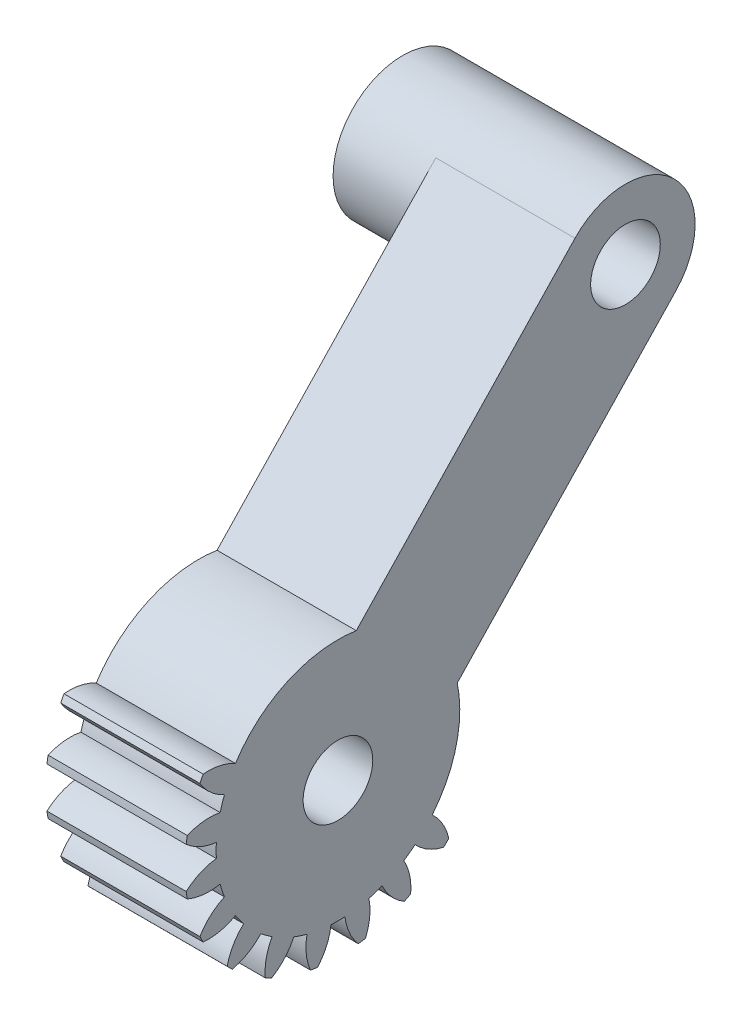
from build123d import *
from build123d.topology import SkipClean

# Parameters (mm, degrees)
SKETCH1_R           = 2.5
BOSS_EXTRUDE1_DEPTH = 10
SKETCH2_R           = 2.5
BOSS_EXTRUDE2_DEPTH = 10
SKETCH3_R           = 5
SKETCH3_R_2         = 2.5
BOSS_EXTRUDE3_DEPTH = 6
SKETCH4_R           = 2.5
CUT_EXTRUDE1_DEPTH  = 41.209967862
CUT_EXTRUDE2_DEPTH  = 41.209967862


with BuildPart() as part:
    # Sketch1 → Boss-Extrude1 (new body)
    with BuildSketch(Plane(origin=(4.043870029, 0, 0), x_dir=(0, 0, -1), z_dir=(1, 0, 0))):
        with BuildLine():
            ThreePointArc((-10.029541992, 0.342879069), (-9.019080639, -0.304016541), (-7.862233613, -0.622153359))
            ThreePointArc((-7.862233613, -0.622153359), (-7.876528296, -1.122077366), (-7.862233613, -1.622001374))
            ThreePointArc((-7.862233613, -1.622001374), (-9.019080639, -1.940138191), (-10.029541992, -2.587033801))
            ThreePointArc((-10.029541992, -2.587033801), (-9.992100042, -2.842856482), (-9.948655897, -3.097728508))
            ThreePointArc((-9.948655897, -3.097728508), (-8.787748306, -3.400713063), (-7.58921172, -3.345793765))
            ThreePointArc((-7.58921172, -3.345793765), (-7.448321757, -3.82566705), (-7.280241692, -4.296705735))
            ThreePointArc((-7.280241692, -4.296705735), (-8.282158911, -4.956757219), (-9.043263028, -5.884241235))
            ThreePointArc((-9.043263028, -5.884241235), (-8.928600062, -6.115972863), (-8.808522437, -6.344945585))
            ThreePointArc((-8.808522437, -6.344945585), (-7.610806331, -6.274360846), (-6.487901298, -5.851761317))
            ThreePointArc((-6.487901298, -5.851761317), (-6.20561798, -6.264610538), (-5.90020538, -6.660655353))
            ThreePointArc((-5.90020538, -6.660655353), (-6.649118154, -7.598011066), (-7.086362862, -8.715294889))
            ThreePointArc((-7.086362862, -8.715294889), (-6.905702889, -8.900251959), (-6.720745819, -9.080911932))
            ThreePointArc((-6.720745819, -9.080911932), (-5.603461996, -8.643667224), (-4.666106283, -7.89475445))
            ThreePointArc((-4.666106283, -7.89475445), (-4.270061468, -8.20016705), (-3.857212247, -8.482450368))
            ThreePointArc((-3.857212247, -8.482450368), (-4.279811776, -9.605355401), (-4.350396515, -10.803071507))
            ThreePointArc((-4.350396515, -10.803071507), (-4.121423793, -10.923149132), (-3.889692165, -11.037812099))
            ThreePointArc((-3.889692165, -11.037812099), (-2.962208149, -10.276707981), (-2.302156665, -9.274790762))
            ThreePointArc((-2.302156665, -9.274790762), (-1.83111798, -9.442870827), (-1.351244695, -9.583760791))
            ThreePointArc((-1.351244695, -9.583760791), (-1.406163992, -10.782297376), (-1.103179437, -11.943204968))
            ThreePointArc((-1.103179437, -11.943204968), (-0.848307411, -11.986649113), (-0.592484731, -12.024091063))
            ThreePointArc((-0.592484731, -12.024091063), (0.054410879, -11.01362971), (0.372547697, -9.856782684))
            ThreePointArc((0.372547697, -9.856782684), (0.872471704, -9.871077366), (1.372395712, -9.856782684))
            ThreePointArc((1.372395712, -9.856782684), (1.690532529, -11.01362971), (2.337428139, -12.024091063))
            ThreePointArc((2.337428139, -12.024091063), (2.59325082, -11.986649113), (2.848122846, -11.943204968))
            ThreePointArc((2.848122846, -11.943204968), (3.151107401, -10.782297376), (3.096188103, -9.583760791))
            ThreePointArc((3.096188103, -9.583760791), (3.576061388, -9.442870827), (4.047100073, -9.274790762))
            ThreePointArc((4.047100073, -9.274790762), (4.707151558, -10.276707981), (5.634635573, -11.037812099))
            ThreePointArc((5.634635573, -11.037812099), (5.866367201, -10.923149132), (6.095339923, -10.803071507))
            ThreePointArc((6.095339923, -10.803071507), (6.024755184, -9.605355401), (5.602155655, -8.482450368))
            ThreePointArc((5.602155655, -8.482450368), (6.015004877, -8.20016705), (6.411049691, -7.89475445))
            ThreePointArc((6.411049691, -7.89475445), (7.348405404, -8.643667224), (8.465689227, -9.080911932))
            ThreePointArc((8.465689227, -9.080911932), (8.650646297, -8.900251959), (8.83130627, -8.715294889))
            ThreePointArc((8.83130627, -8.715294889), (8.394061563, -7.598011066), (7.645148788, -6.660655353))
            ThreePointArc((7.645148788, -6.660655353), (7.950561388, -6.264610538), (8.232844706, -5.851761317))
            ThreePointArc((8.232844706, -5.851761317), (9.355749739, -6.274360846), (10.553465846, -6.344945585))
            ThreePointArc((10.553465846, -6.344945585), (10.67354347, -6.115972863), (10.788206437, -5.884241235))
            ThreePointArc((10.788206437, -5.884241235), (10.02710232, -4.956757219), (9.0251851, -4.296705735))
            ThreePointArc((9.0251851, -4.296705735), (9.193265165, -3.82566705), (9.334155129, -3.345793765))
            ThreePointArc((9.334155129, -3.345793765), (10.532691714, -3.400713063), (11.693599306, -3.097728508))
            ThreePointArc((11.693599306, -3.097728508), (11.737043451, -2.842856482), (11.774485401, -2.587033801))
            ThreePointArc((11.774485401, -2.587033801), (10.764024048, -1.940138191), (9.607177022, -1.622001374))
            ThreePointArc((9.607177022, -1.622001374), (9.621471704, -1.122077366), (9.607177022, -0.622153359))
            ThreePointArc((9.607177022, -0.622153359), (10.764024048, -0.304016541), (11.774485401, 0.342879069))
            ThreePointArc((11.774485401, 0.342879069), (11.737043451, 0.598701749), (11.693599306, 0.853573775))
            ThreePointArc((11.693599306, 0.853573775), (10.532691714, 1.156558331), (9.334155129, 1.101639033))
            ThreePointArc((9.334155129, 1.101639033), (9.193265165, 1.581512318), (9.0251851, 2.052551003))
            ThreePointArc((9.0251851, 2.052551003), (10.02710232, 2.712602487), (10.788206437, 3.640086503))
            ThreePointArc((10.788206437, 3.640086503), (10.67354347, 3.871818131), (10.553465846, 4.100790853))
            ThreePointArc((10.553465846, 4.100790853), (9.355749739, 4.030206114), (8.232844706, 3.607606585))
            ThreePointArc((8.232844706, 3.607606585), (7.950561388, 4.020455806), (7.645148788, 4.416500621))
            ThreePointArc((7.645148788, 4.416500621), (8.394061563, 5.353856334), (8.83130627, 6.471140157))
            ThreePointArc((8.83130627, 6.471140157), (8.650646297, 6.656097227), (8.465689227, 6.8367572))
            ThreePointArc((8.465689227, 6.8367572), (7.348405404, 6.399512492), (6.411049691, 5.650599718))
            ThreePointArc((6.411049691, 5.650599718), (6.015004877, 5.956012318), (5.602155655, 6.238295636))
            ThreePointArc((5.602155655, 6.238295636), (6.024755184, 7.361200669), (6.095339923, 8.558916775))
            ThreePointArc((6.095339923, 8.558916775), (5.866367201, 8.6789944), (5.634635573, 8.793657366))
            ThreePointArc((5.634635573, 8.793657366), (4.707151558, 8.032553249), (4.047100073, 7.03063603))
            ThreePointArc((4.047100073, 7.03063603), (3.576061388, 7.198716095), (3.096188103, 7.339606058))
            ThreePointArc((3.096188103, 7.339606058), (3.151107401, 8.538142644), (2.848122846, 9.699050235))
            ThreePointArc((2.848122846, 9.699050235), (2.59325082, 9.74249438), (2.337428139, 9.779936331))
            ThreePointArc((2.337428139, 9.779936331), (1.690532529, 8.769474978), (1.372395712, 7.612627952))
            ThreePointArc((1.372395712, 7.612627952), (0.872471704, 7.626922634), (0.372547697, 7.612627952))
            ThreePointArc((0.372547697, 7.612627952), (0.054410879, 8.769474978), (-0.592484731, 9.779936331))
            ThreePointArc((-0.592484731, 9.779936331), (-0.848307411, 9.74249438), (-1.103179437, 9.699050235))
            ThreePointArc((-1.103179437, 9.699050235), (-1.406163992, 8.538142644), (-1.351244695, 7.339606058))
            ThreePointArc((-1.351244695, 7.339606058), (-1.83111798, 7.198716095), (-2.302156665, 7.03063603))
            ThreePointArc((-2.302156665, 7.03063603), (-2.962208149, 8.032553249), (-3.889692165, 8.793657366))
            ThreePointArc((-3.889692165, 8.793657366), (-4.121423793, 8.6789944), (-4.350396515, 8.558916775))
            ThreePointArc((-4.350396515, 8.558916775), (-4.279811776, 7.361200669), (-3.857212247, 6.238295636))
            ThreePointArc((-3.857212247, 6.238295636), (-4.270061468, 5.956012318), (-4.666106283, 5.650599718))
            ThreePointArc((-4.666106283, 5.650599718), (-5.603461996, 6.399512492), (-6.720745819, 6.8367572))
            ThreePointArc((-6.720745819, 6.8367572), (-6.905702889, 6.656097227), (-7.086362862, 6.471140157))
            ThreePointArc((-7.086362862, 6.471140157), (-6.649118154, 5.353856334), (-5.90020538, 4.416500621))
            ThreePointArc((-5.90020538, 4.416500621), (-6.20561798, 4.020455806), (-6.487901298, 3.607606585))
            ThreePointArc((-6.487901298, 3.607606585), (-7.610806331, 4.030206114), (-8.808522437, 4.100790853))
            ThreePointArc((-8.808522437, 4.100790853), (-8.928600062, 3.871818131), (-9.043263028, 3.640086503))
            ThreePointArc((-9.043263028, 3.640086503), (-8.282158911, 2.712602487), (-7.280241692, 2.052551003))
            ThreePointArc((-7.280241692, 2.052551003), (-7.448321757, 1.581512318), (-7.58921172, 1.101639033))
            ThreePointArc((-7.58921172, 1.101639033), (-8.787748306, 1.156558331), (-9.948655897, 0.853573775))
            ThreePointArc((-9.948655897, 0.853573775), (-9.992100042, 0.598701749), (-10.029541992, 0.342879069))
        make_face()
        with Locations((0.872471704, -1.122077366)):
            Circle(SKETCH1_R, mode=Mode.SUBTRACT)
    extrude(amount=-BOSS_EXTRUDE1_DEPTH)

    # Sketch2 → Boss-Extrude2 (add)
    with BuildSketch(Plane(origin=(4.043870029, 0, 0), x_dir=(0, 0, -1), z_dir=(1, 0, 0))):
        with BuildLine():
            Line((17.89623712, 24.080926643), (-2.754400151, 2.319695512))
            ThreePointArc((-2.754400151, 2.319695512), (-2.569301174, -4.748949221), (4.499343559, -4.563850245))
            Line((4.499343559, -4.563850245), (25.14998083, 17.197380886))
            ThreePointArc((25.14998083, 17.197380886), (26.523055214, 20.662340065), (25.117904395, 24.114415753))
            ThreePointArc((25.117904395, 24.114415753), (24.964881853, 24.266025619), (24.805471182, 24.410903801))
            ThreePointArc((24.805471182, 24.410903801), (21.284586532, 25.633461228), (17.89623712, 24.080926643))
        make_face()
        with Locations((21.523108975, 20.639153764)):
            Circle(SKETCH2_R, mode=Mode.SUBTRACT)
    extrude(amount=-BOSS_EXTRUDE2_DEPTH)

    # Sketch3 → Boss-Extrude3 (add)
    with SkipClean():  # the faces are left unmerged after this step: merging them gives an invalid solid
        with BuildSketch(Plane.ZY.offset(5.956129971)):
            with Locations((-21.523108975, 20.639153764)):
                Circle(SKETCH3_R)
            with Locations((-21.523108975, 20.639153764)):
                Circle(SKETCH3_R_2, mode=Mode.SUBTRACT)
        extrude(amount=BOSS_EXTRUDE3_DEPTH)
    add(part.part.scale(1), mode=Mode.REPLACE)  # the faces are merged on a copy

    # Sketch4 → Cut-Extrude1 (cut, through all)
    with BuildSketch(Plane(origin=(4.043870029, 0, 0), x_dir=(0, 0, -1), z_dir=(1, 0, 0))):
        with Locations((0.872471704, -1.122077366)):
            Circle(SKETCH4_R)
    extrude(amount=-CUT_EXTRUDE1_DEPTH, mode=Mode.SUBTRACT)

    # Sketch6 → Cut-Extrude2 (cut, through all)
    with BuildSketch(Plane(origin=(4.043870029, 0, 0), x_dir=(0, 0, -1), z_dir=(1, 0, 0))):
        with BuildLine():
            Line((4.579688985, 10.048212881), (2.187631015, 7.527509733))
            ThreePointArc((2.187631015, 7.527509733), (-2.46576826, 6.965020688), (-6.16100093, 4.08131227))
            Line((-6.16100093, 4.08131227), (-8.58915512, 5.877669916))
            ThreePointArc((-8.58915512, 5.877669916), (-2.68093011, 10.098091069), (4.579688985, 10.048212881))
        make_face()
        with BuildLine():
            Line((11.833432695, 3.164667124), (9.441374725, 0.643963976))
            ThreePointArc((9.441374725, 0.643963976), (9.424184018, -2.969566881), (7.948146758, -6.267932352))
            Line((7.948146758, -6.267932352), (10.39087042, -8.044427405))
            ThreePointArc((10.39087042, -8.044427405), (12.54560297, -2.624359175), (11.833432695, 3.164667124))
        make_face()
    extrude(amount=-CUT_EXTRUDE2_DEPTH, mode=Mode.SUBTRACT)


solid = part.part
